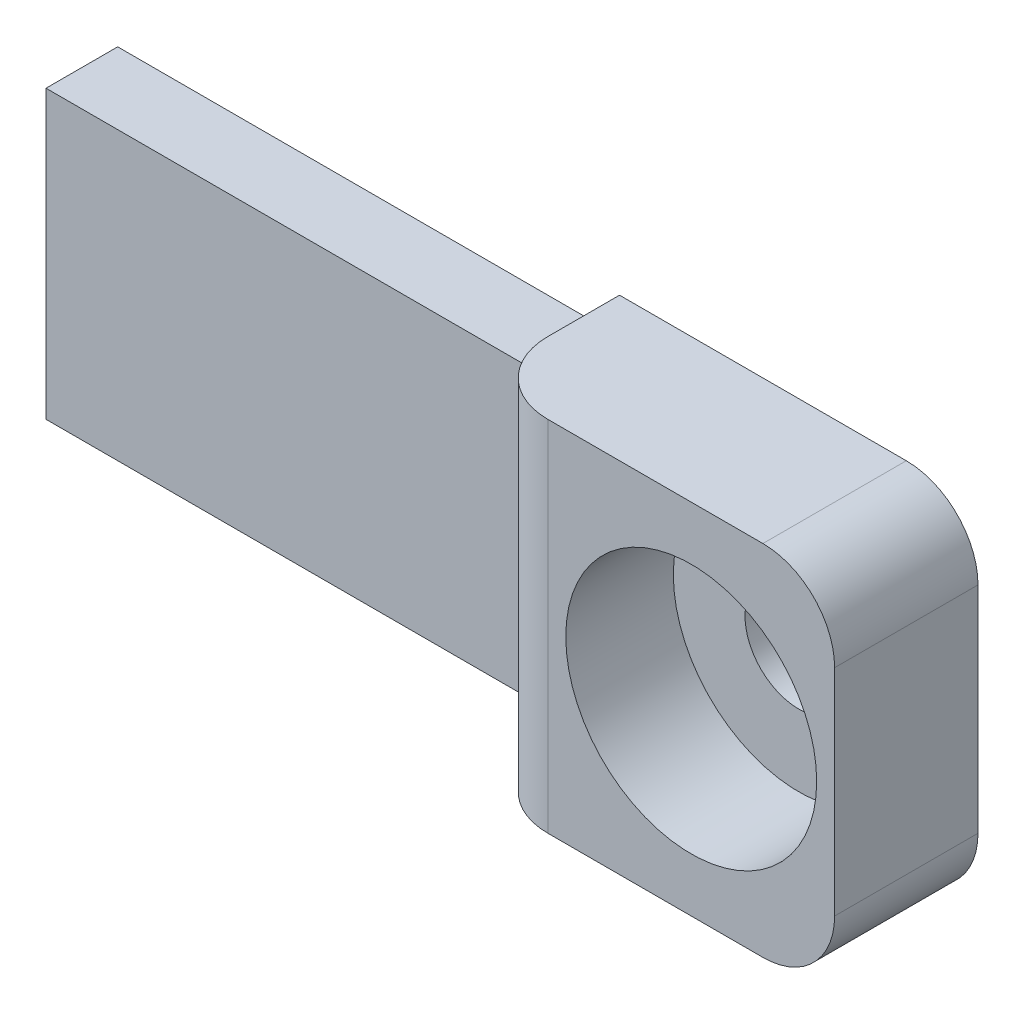
from build123d import *

# Parameters (mm, degrees)
BOSS_EXTRUDE1_DEPTH = 20
CUT_EXTRUDE1_REACH  = 78.974
SKETCH2_R           = 7.5
SKETCH3_R           = 17.5
CUT_EXTRUDE2_DEPTH  = 15
SKETCH4_W           = 10
SKETCH4_H           = 40
CUT_EXTRUDE3_DEPTH  = 70
FILLET1_R           = 10
FILLET2_START       = -26
FILLET2_DEPTH       = 52


with BuildPart() as part:
    # Sketch1 → Boss-Extrude1 (new body)
    with BuildSketch(Plane.XY):
        Polygon((-70, 20), (0, 20), (0, 25), (50, 25), (50, -25), (0, -25), (0, -20), (-70, -20), align=None)
    extrude(amount=BOSS_EXTRUDE1_DEPTH)

    # Sketch2 → Cut-Extrude1 (cut, up to next)
    with BuildSketch(Plane.XY.offset(20), mode=Mode.PRIVATE) as cut_extrude1_sk1:
        with Locations((30, 0)):
            Circle(SKETCH2_R)
    cut_extrude1_tool1 = extrude(cut_extrude1_sk1.sketch, amount=-CUT_EXTRUDE1_REACH, mode=Mode.PRIVATE) & part.part
    add(cut_extrude1_tool1.solids().sort_by_distance((30, 0, 20))[0], mode=Mode.SUBTRACT)

    # Sketch3 → Cut-Extrude2 (cut)
    with BuildSketch(Plane.XY.offset(20)):
        with Locations((30, 0)):
            Circle(SKETCH3_R)
    extrude(amount=-CUT_EXTRUDE2_DEPTH, mode=Mode.SUBTRACT)

    # Sketch4 → Cut-Extrude3 (cut)
    with BuildSketch(Plane.ZY.offset(70)):
        with Locations((15, 0)):
            Rectangle(SKETCH4_W, SKETCH4_H)
    extrude(amount=-CUT_EXTRUDE3_DEPTH, mode=Mode.SUBTRACT)

    # Fillet1
    fillet1_edges = [part.edges().sort_by_distance(p)[0] for p in [
        (50, 25, 10),
        (50, -25, 10),
    ]]
    fillet(fillet1_edges, radius=FILLET1_R)

    # Fillet2: read off the stored shape, not the designer's step
    # Fillet2 outline → Fillet2 (cut)
    with BuildSketch(Plane(origin=(0, 0, 0), x_dir=(1, 0, 0), z_dir=(0, 1, 0)).offset(FILLET2_START)):
        with BuildLine():
            ThreePointArc((10, -20), (2.928932188, -17.071067812), (0, -10))
            Line((0, -10), (0, -20))
            Line((0, -20), (10, -20))
        make_face()
    extrude(amount=FILLET2_DEPTH, mode=Mode.SUBTRACT)


solid = part.part
